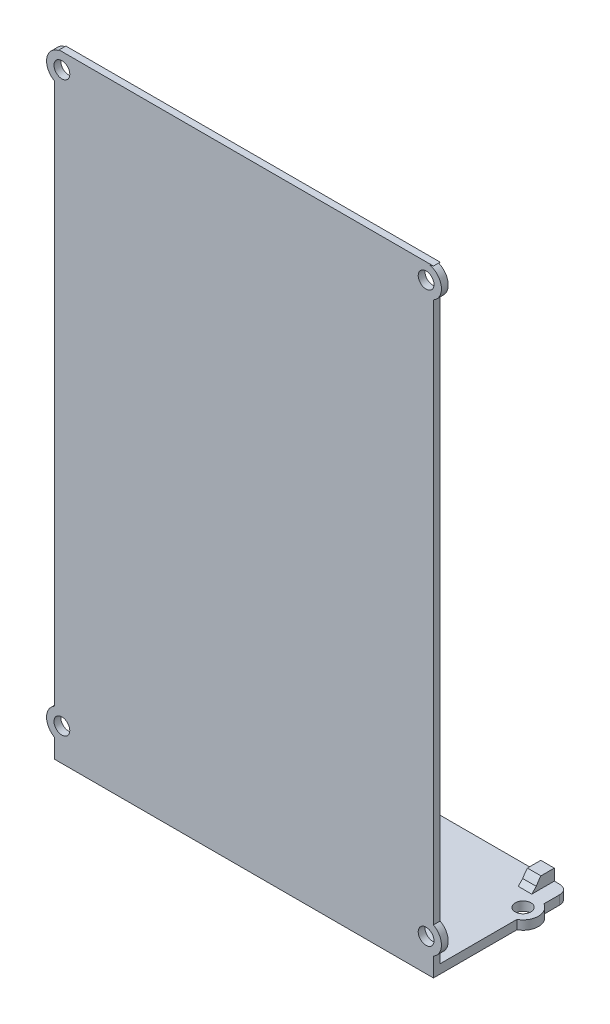
from build123d import *

# Parameters (mm, degrees)
SKETCH1_R                = 1.75
BOSS_EXTRUDE1_DEPTH      = 1.5
BOSS_EXTRUDE2_DEPTH      = 84
BOSS_EXTRUDE3_DEPTH      = 1.5
BOSS_EXTRUDE3_DEPTH_BACK = 1.5
BOSS_EXTRUDE4_DEPTH      = 2
SKETCH5_R                = 1.75
CUT_EXTRUDE1_DEPTH       = 2
CUT_EXTRUDE2_DEPTH       = 150.007183132
CUT_EXTRUDE2_DEPTH_BACK  = 150.007183132
SKETCH6_W                = 84
SKETCH6_H                = 11.5
BOSS_EXTRUDE6_START      = -2
SKETCH7_W                = 3
SKETCH7_H                = 4
BOSS_EXTRUDE6_DEPTH      = 2.5
FILLET1_R                = 2
CHAMFER1_SIZE            = 1
FILLET2_R                = 8
SKETCH8_W                = 26
SKETCH8_H                = 23
CUT_EXTRUDE3_DEPTH       = 22.4262221


with BuildPart() as part:
    # Sketch1 → Boss-Extrude1 (new body)
    with BuildSketch(Plane.XY):
        with BuildLine():
            Line((-38.75, -134.5), (38.75, -134.5))
            Line((38.75, -134.5), (42, -134.5))
            Line((42, -134.5), (42, -132.48653227))
            ThreePointArc((42, -132.48653227), (43.775, -129.5), (42, -126.51346773))
            Line((42, -126.51346773), (42, -6.48653227))
            ThreePointArc((42, -6.48653227), (43.741212037, -3.021861398), (41.104087703, -0.179091823))
            Line((41.104087703, -0.179091823), (42, 0))
            Line((42, 0), (-41, 0))
            Line((-41, 0), (-41.193033114, -0.199875483))
            ThreePointArc((-41.193033114, -0.199875483), (-43.747330957, -3.067121364), (-42, -6.48653227))
            Line((-42, -6.48653227), (-42, -126.51346773))
            ThreePointArc((-42, -126.51346773), (-43.775, -129.5), (-42, -132.48653227))
            Line((-42, -132.48653227), (-42, -134.5))
            Line((-42, -134.5), (-38.75, -134.5))
        make_face()
        with Locations((-40.375, -129.5)):
            Circle(SKETCH1_R, mode=Mode.SUBTRACT)
        with Locations((40.375, -129.5)):
            Circle(SKETCH1_R, mode=Mode.SUBTRACT)
        with Locations((40.375, -3.5)):
            Circle(SKETCH1_R, mode=Mode.SUBTRACT)
        with Locations((-40.375, -3.5)):
            Circle(SKETCH1_R, mode=Mode.SUBTRACT)
    extrude(amount=BOSS_EXTRUDE1_DEPTH)

    # Sketch2 → Boss-Extrude2 (add)
    with BuildSketch(Plane.ZY.offset(42)):
        Polygon((1.5, -134.5), (1.5, -136.7), (-40, -136.7), (-40, -134.7), (0, -134.7), (0, -134.5), (0, -132.48653227), (1.5, -132.48653227), align=None)
    extrude(amount=-BOSS_EXTRUDE2_DEPTH)

    # Sketch3 → Boss-Extrude3 (add, two sides: drawn at the far end of the back side and taken through both)
    with BuildSketch(Plane(origin=(-15, 0, 0), x_dir=(0, 0, -1), z_dir=(1, 0, 0)).offset(-BOSS_EXTRUDE3_DEPTH_BACK)):
        Polygon((0, -119.7), (15, -134.7), (0, -134.7), align=None)
    extrude(amount=BOSS_EXTRUDE3_DEPTH + BOSS_EXTRUDE3_DEPTH_BACK)

    # Sketch4 → Boss-Extrude4 (add)
    with BuildSketch(Plane.XZ.offset(136.7)):
        with BuildLine():
            Line((-42, -17.01346773), (-42, -22.98653227))
            ThreePointArc((-42, -22.98653227), (-43.775, -20), (-42, -17.01346773))
        make_face()
        with BuildLine():
            Line((42, -17.01346773), (42, -22.98653227))
            ThreePointArc((42, -22.98653227), (43.775, -20), (42, -17.01346773))
        make_face()
    extrude(amount=-BOSS_EXTRUDE4_DEPTH)

    # Sketch5 → Cut-Extrude1 (cut)
    with BuildSketch(Plane.XZ.offset(136.7)):
        with Locations(Location((40.375, -20, 0), (0, 0, 270))):
            Circle(SKETCH5_R)
        with Locations(Location((-40.375, -20, 0), (0, 0, 270))):
            Circle(SKETCH5_R)
    extrude(amount=-CUT_EXTRUDE1_DEPTH, mode=Mode.SUBTRACT)

    # Sketch6 → Cut-Extrude2 (cut, two sides: drawn at the far end of the back side and taken through both)
    with BuildSketch(Plane.XZ.offset(136.7).offset(-CUT_EXTRUDE2_DEPTH_BACK)):
        with Locations((0, -34.25)):
            Rectangle(SKETCH6_W, SKETCH6_H)
    extrude(amount=CUT_EXTRUDE2_DEPTH + CUT_EXTRUDE2_DEPTH_BACK, mode=Mode.SUBTRACT)

    # Sketch7 → Boss-Extrude6 (add)
    with BuildSketch(Plane.XZ.offset(136.7).offset(BOSS_EXTRUDE6_START)):
        with Locations((-37.3, -26.5)):
            Rectangle(SKETCH7_W, SKETCH7_H)
        with Locations((37.3, -26.5)):
            Rectangle(SKETCH7_W, SKETCH7_H)
    extrude(amount=-BOSS_EXTRUDE6_DEPTH)

    # Fillet1
    fillet1_edges = [part.edges().sort_by_distance(p)[0] for p in [
        (42, -135.7, -28.5),
        (-42, -135.7, -28.5),
    ]]
    fillet(fillet1_edges, radius=FILLET1_R)

    # Chamfer1
    chamfer1_edges = [part.edges().sort_by_distance(p)[0] for p in [
        (-37.3, -134.7, -24.5),
        (-37.3, -132.2, -24.5),
        (37.3, -134.7, -24.5),
        (37.3, -132.2, -24.5),
    ]]
    chamfer(chamfer1_edges, length=CHAMFER1_SIZE)

    # Fillet2
    # the kernel refuses this fillet: 8 mm, written as the material it takes off along each edge
    with BuildSketch(Plane(origin=(-30.803909917, -133.2, -24.5), x_dir=(0, -1.0, -1.118394266079786e-11), z_dir=(-1, 0, 0))) as fillet2_piece_1:
        with BuildLine():
            CenterArc((4.243746579, -7.06996192), FILLET2_R, 117.902496562, 17.097503438)
            Line((-1.413107671, -1.413107671), (0, 0))
            Line((0, 0), (0.5, 0))
        make_face()
    extrude(amount=12.992180166, mode=Mode.SUBTRACT)
    with BuildSketch(Plane(origin=(30.803909917, -133.2, -24.5), x_dir=(0, 0.7071067811865501, -0.7071067811865448), z_dir=(1, 0, 0))) as fillet2_piece_2:
        with BuildLine():
            CenterArc((1.998436033, -8), FILLET2_R, 90, 17.097503438)
            Line((-0.353553391, -0.353553391), (0, 0))
            Line((0, 0), (1.998436033, 0))
        make_face()
    extrude(amount=12.992180166, mode=Mode.SUBTRACT)

    # Sketch8 → Cut-Extrude3 (cut)
    with BuildSketch(Plane.XZ.offset(136.7)):
        with Locations((3, -14)):
            Rectangle(SKETCH8_W, SKETCH8_H)
    extrude(amount=-CUT_EXTRUDE3_DEPTH, mode=Mode.SUBTRACT)


solid = part.part
